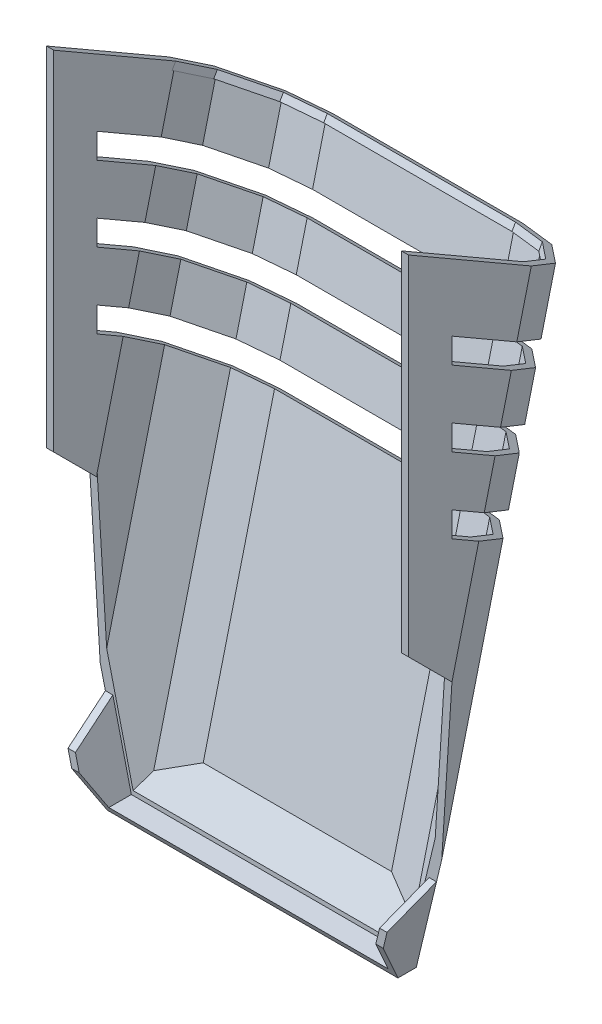
from build123d import *
from OCP.BRepFilletAPI import BRepFilletAPI_MakeChamfer

# Parameters (mm, degrees)
BOSS_EXTRU_1_DEPTH                  = 500
CHANFREIN2_SIZE                     = 80
CHANFREIN3_SIZE                     = 19.999999999999996
CHANFREIN3_SIZE2                    = 38.63703305156302
CHANFREIN3_SIZE2_2                  = 38.63703305156301
CHANFREIN4_SIZE                     = 190.00000000000003
CHANFREIN4_SIZE2                    = 127.87558157978762
BOSS_EXTRU_2_DEPTH                  = 60
BOSS_EXTRU_3_DEPTH                  = 500
COQUE1_T                            = 10
ENL_V_MAT_EXTRU_2_REACH             = 940.137
ENL_V_MAT_EXTRU_2_DIRECTION_2_DEPTH = 939.1366191668232
ENL_V_START                         = -60
ENL_V_MAT_EXTRU_3_DEPTH             = 60
ENL_V_MAT_EXTRU_4_DEPTH             = 1170.3404261816813
CHANFREIN6_SIZE                     = 34.641016151
CHANFREIN6_SIZE_2                   = 60
CHANFREIN7_SIZE                     = 60
ENL_V_MAT_EXTRU_5_DEPTH             = 1170.3404261816813


# Some blends are built 0.0001 mm under size
with BuildPart() as part:
    # Esquisse3 → Boss.-Extru.1 (new body)
    with BuildSketch(Plane(origin=(0, 0, 0), x_dir=(0, 0, -1), z_dir=(1, 0, 0))):
        Polygon((0, 0), (0, 1000), (216.50635094611002, 875.0000000000006), align=None)
    extrude(amount=BOSS_EXTRU_1_DEPTH)

    # Chanfrein2
    chanfrein2_edges = [part.edges().sort_by_distance(p)[0] for p in [
        (500, 437.5000000000003, -108.25317547305501),
        (0, 437.5000000000003, -108.25317547305501),
    ]]
    chamfer(chanfrein2_edges, length=CHANFREIN2_SIZE)

    # Chanfrein3: one chamfer whose edges measure the first distance from different faces: ONE call of the kernel's chamfer builder (chamfer() names one face for all edges)
    chanfrein3_edges_1 = [part.edges().sort_by_distance(p)[0] for p in [
        (500, 624.8499399519503, -72.19766271841472),
        (420, 437.5000000000003, -108.25317547305504),
    ]]
    chanfrein3_side_1 = [part.faces().sort_by_distance(p)[0] for p in [
        (457.3358939482921, 524.9359686158087, -91.42611546732361),
    ]]
    chanfrein3_edges_2 = [part.edges().sort_by_distance(p)[0] for p in [
        (80, 437.50000000000017, -108.25317547305501),
        (0, 624.8499399519503, -72.1976627184147),
    ]]
    chanfrein3_side_2 = [part.faces().sort_by_distance(p)[0] for p in [
        (42.664106051707925, 524.9359686158089, -91.42611546732363),
    ]]
    chanfrein3 = BRepFilletAPI_MakeChamfer(part.part.solid().wrapped)
    for e in chanfrein3_edges_1:
        chanfrein3.Add(CHANFREIN3_SIZE, CHANFREIN3_SIZE2, e.wrapped, chanfrein3_side_1[0].wrapped)  # the first distance lies on this face
    for e in chanfrein3_edges_2:
        chanfrein3.Add(CHANFREIN3_SIZE, CHANFREIN3_SIZE2_2, e.wrapped, chanfrein3_side_2[0].wrapped)  # the first distance lies on this face
    add(Compound.cast(chanfrein3.Shape()), mode=Mode.REPLACE)

    # Chanfrein4
    chanfrein4_edges = [part.edges().sort_by_distance(p)[0] for p in [
        (249.99999999999994, 0, 0),
    ]]
    chanfrein4_side = [part.faces().sort_by_distance(p)[0] for p in [
        (249.99999999999997, 437.5000000000003, -108.25317547305502),
    ]]
    chamfer(chanfrein4_edges, length=CHANFREIN4_SIZE, length2=CHANFREIN4_SIZE2, reference=chanfrein4_side[0])

    # Esquisse4 → Boss.-Extru.2 (add)
    with BuildSketch(Plane.XY):
        Polygon((500, 1000), (0, 1000), (6.94e-15, 493.9253559619593), (14.142135623731011, 274.1881541390633), (49.28527880731526, 127.87558157978796), (450.7147211926849, 127.87558157978796), (485.85786437626905, 274.18815413906196), (500, 493.92535596195466), align=None)
    extrude(amount=BOSS_EXTRU_2_DEPTH)

    # Esquisse5 → Boss.-Extru.3 (add)
    with BuildSketch(Plane.ZY):
        Polygon((60, 1000), (60, 1034.6410161513777), (0, 1000), align=None)
    extrude(amount=-BOSS_EXTRU_3_DEPTH)

    # Coque1 (no face opened: a closed hollow body)
    add(offset(amount=-COQUE1_T, mode=Mode.PRIVATE), mode=Mode.SUBTRACT)

    # Esquisse6 → Enlèv. mat.-Extru.2 (cut, up to next)
    with BuildSketch(Plane(origin=(0, 750.0000000000025, -433.0127018922181), x_dir=(1, 0, 0), z_dir=(0, 0.86602540378444, -0.49999999999999784)), mode=Mode.PRIVATE) as enl_v_mat_extru_2_sk1:
        Polygon((10, -569.2820323027529), (10, -757.501187283232), (489.99999999999983, -757.5011872832318), (489.99999999999994, -569.2820323027527), (489.9999999999996, -374.7478772728107), (476.8280711810083, -323.58228852611177), (428.823967356419, -273.61803314286686), (379.9946243192759, -259.99999999999744), (120.00537568072383, -259.99999999999756), (71.17603264358065, -273.618033142867), (23.171928818991503, -323.58228852611194), (10.000000000000268, -374.74787727281085), align=None)
    enl_v_mat_extru_2_tool1 = extrude(enl_v_mat_extru_2_sk1.sketch, amount=-ENL_V_MAT_EXTRU_2_REACH, mode=Mode.PRIVATE) & part.part
    add(enl_v_mat_extru_2_tool1.solids().sort_by_distance((250, 1007.562635, 13.098868))[0], mode=Mode.SUBTRACT)

    # Esquisse6 → Enlèv. mat.-Extru.2 direction 2 (cut)
    with BuildSketch(Plane(origin=(0, 750.0000000000025, -433.0127018922181), x_dir=(1, 0, 0), z_dir=(0, 0.86602540378444, -0.49999999999999784))):
        Polygon((10, -569.2820323027529), (10, -757.501187283232), (489.99999999999983, -757.5011872832318), (489.99999999999994, -569.2820323027527), (489.9999999999996, -374.7478772728107), (476.8280711810083, -323.58228852611177), (428.823967356419, -273.61803314286686), (379.9946243192759, -259.99999999999744), (120.00537568072383, -259.99999999999756), (71.17603264358065, -273.618033142867), (23.171928818991503, -323.58228852611194), (10.000000000000268, -374.74787727281085), align=None)
    extrude(amount=ENL_V_MAT_EXTRU_2_DIRECTION_2_DEPTH, mode=Mode.SUBTRACT)

    # Esquisse7 → Enlèv. mat.-Extru.3 (cut)
    with BuildSketch(Plane.XY.offset(60).offset(ENL_V_START)):
        Polygon((475.93370620438793, 275.68803078848794), (442.8322266096682, 137.87558157978802), (57.16777339033198, 137.87558157978796), (24.066293795611983, 275.6880307884899), (10.000000000000009, 494.2468199914388), (10, 1034.6410161513777), (489.99999999999864, 1034.6410161513782), (489.9999999999996, 494.2468199914393), align=None)
    extrude(amount=ENL_V_MAT_EXTRU_3_DEPTH, mode=Mode.SUBTRACT)

    # Esquisse8 → Enlèv. mat.-Extru.4 (cut, through all)
    with BuildSketch(Plane(origin=(500, 0, 0), x_dir=(0, 0, -1), z_dir=(1, 0, 0))):
        Polygon((-60, 493.92535596195466), (0, 493.92535596195466), (-1.388e-14, 274.18815413906196), (-1.388e-14, 244.18815413906194), (-59.99999999999999, 244.18815413906194), (-60, 274.18815413906196), align=None)
    extrude(amount=-ENL_V_MAT_EXTRU_4_DEPTH, mode=Mode.SUBTRACT)

    # Chanfrein6
    # the kernel refuses this chamfer: 60, 34.641016151 mm, written as the material it takes off along each edge
    with BuildSketch(Plane(origin=(186.85746471381282, 244.1881541390619, 60), x_dir=(0, -0.9983227437537926, 0.05789386240267061), z_dir=(-1, 0, 0))) as chanfrein6_piece_1_section:
        Polygon((CHANFREIN6_SIZE * 0.998322743765, -CHANFREIN6_SIZE * 0.0578938624033), (-CHANFREIN6_SIZE_2 * 0.0578938624027, -CHANFREIN6_SIZE_2 * 0.998322743754), (0, 0), align=None)
    chanfrein6_piece_1 = extrude(amount=320.73470744761204, mode=Mode.PRIVATE)
    chanfrein6_piece_1 = split(chanfrein6_piece_1, bisect_by=Plane(origin=(26.49011099000677, 233.04123739645672, 1.648e-14), z_dir=(0, 6e-17, 1)), keep=Keep.TOP, mode=Mode.PRIVATE)
    add(chanfrein6_piece_1, mode=Mode.SUBTRACT)
    with BuildSketch(Plane(origin=(-105.93986647144428, 127.87558157978796, 60), x_dir=(0, -0.05789386240267084, -0.9983227437537926), z_dir=(1, 0, 0))) as chanfrein6_piece_2:
        Polygon((CHANFREIN6_SIZE * 0.998322743765, CHANFREIN6_SIZE * 0.0578938624033), (-CHANFREIN6_SIZE_2 * 0.0578938624027, CHANFREIN6_SIZE_2 * 0.998322743754), (0, 0), align=None)
    extrude(amount=711.8797329428887, mode=Mode.SUBTRACT)
    with BuildSketch(Plane(origin=(633.8772427337997, 244.1881541390619, 60), x_dir=(0, -0.9983227437537926, 0.05789386240267061), z_dir=(-1, 0, 0))) as chanfrein6_piece_3_section:
        Polygon((CHANFREIN6_SIZE * 0.998322743765, -CHANFREIN6_SIZE * 0.0578938624033), (-CHANFREIN6_SIZE_2 * 0.0578938624027, -CHANFREIN6_SIZE_2 * 0.998322743754), (0, 0), align=None)
    chanfrein6_piece_3 = extrude(amount=320.7347074476121, mode=Mode.PRIVATE)
    chanfrein6_piece_3 = split(chanfrein6_piece_3, bisect_by=Plane(origin=(473.5098890099937, 233.04123739645678, 1.648e-14), z_dir=(0, 6e-17, 1)), keep=Keep.TOP, mode=Mode.PRIVATE)
    add(chanfrein6_piece_3, mode=Mode.SUBTRACT)

    # Chanfrein7
    chanfrein7_edges = [part.edges().sort_by_distance(p)[0] for p in [
        (5.010344602246278, 493.92535596195466, 60),
        (494.98965539775355, 493.92535596195466, 60),
    ]]
    chamfer(chanfrein7_edges, length=CHANFREIN7_SIZE - 0.0001)  # a hair under: the kernel refuses the full size

    # Esquisse10 → Enlèv. mat.-Extru.5 (cut, through all)
    with BuildSketch(Plane(origin=(500, 0, 0), x_dir=(0, 0, -1), z_dir=(1, 0, 0))):
        Polygon((196.50635094610988, 794.1709623134528), (2.06e-15, 907.6239569296604), (4.01e-15, 872.9829407782828), (189.0063509461099, 763.8600731809975), align=None)
        Polygon((174.00635094610982, 703.2382949160867), (1.402e-14, 803.7009084755275), (1.911e-14, 769.0598923241499), (166.50635094610982, 672.9274057836313), align=None)
        Polygon((151.50635094610985, 612.3056275187206), (2.603e-14, 699.7778600213949), (3.259e-14, 665.1368438700174), (144.00635094610985, 581.9947383862652), align=None)
    extrude(amount=-ENL_V_MAT_EXTRU_5_DEPTH, mode=Mode.SUBTRACT)


solid = part.part
